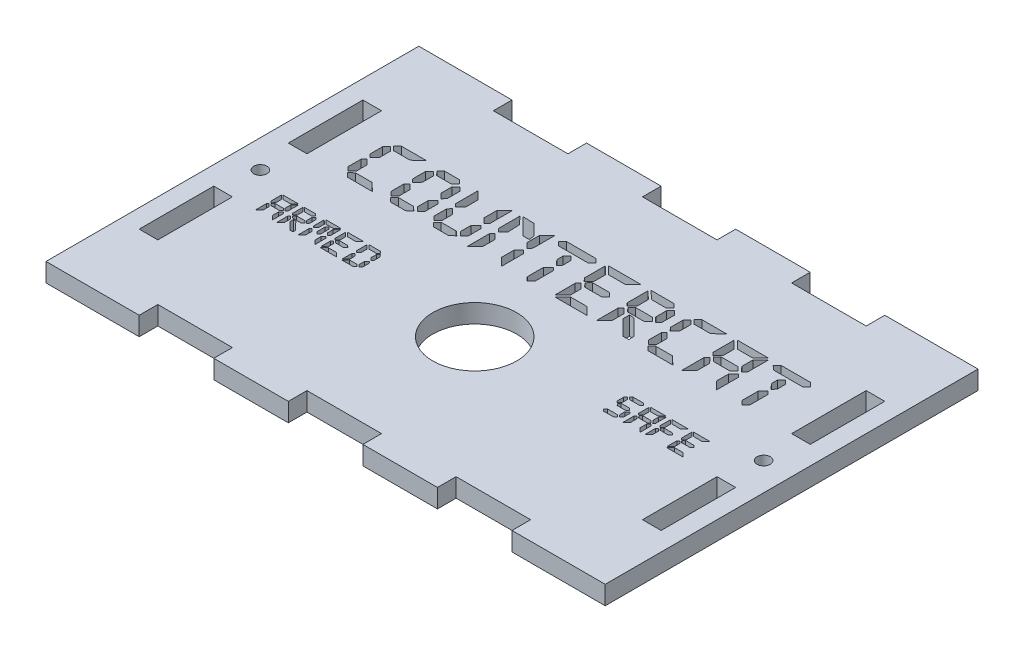
from build123d import *

# Parameters (mm, degrees)
SKETCH1_W                 = 190.5
SKETCH1_H                 = 127
BOSS_EXTRUDE1_DEPTH       = 6.35
SKETCH13_W                = 25.4
SKETCH13_H                = 6.35
CUT_EXTRUDE6_DEPTH        = 6.35
LPATTERN7_COUNT           = 2
LPATTERN7_PITCH           = 120.65
SKETCH14_W                = 6.35
SKETCH14_H                = 25.4
CUT_EXTRUDE7_DEPTH        = 6.35
F_8_CLEARANCE_HOLE1_D     = 4.4958
F_8_CLEARANCE_HOLE1_DEPTH = 10.16
F_8_CLEARANCE_HOLE1_TIP   = 1.350674586
SKETCH18_R                = 14.2875
CUT_EXTRUDE9_DEPTH        = 7.62
CUT_EXTRUDE10_DEPTH       = 10.16
CUT_EXTRUDE11_DEPTH       = 10.16


with BuildPart() as part:
    # Sketch1 → Boss-Extrude1 (new body)
    with BuildSketch(Plane(origin=(0, 0, 0), x_dir=(1, 0, 0), z_dir=(0, 1, 0))):
        with Locations((95.25, 63.5)):
            Rectangle(SKETCH1_W, SKETCH1_H)
    extrude(amount=BOSS_EXTRUDE1_DEPTH)

    # Sketch13 → Cut-Extrude6 (cut)
    with BuildSketch(Plane(origin=(0, 6.35, 0), x_dir=(1, 0, 0), z_dir=(0, 1, 0))):
        with Locations((44.45, 3.175)):
            Rectangle(SKETCH13_W, SKETCH13_H)
        with Locations((95.25, 3.175)):
            Rectangle(SKETCH13_W, SKETCH13_H)
        with Locations((146.05, 3.175)):
            Rectangle(SKETCH13_W, SKETCH13_H)
    cut_extrude6 = extrude(amount=-CUT_EXTRUDE6_DEPTH, mode=Mode.SUBTRACT)

    # LPattern7: Cut-Extrude6 ×2
    with Locations(*[(0, 0, -i * LPATTERN7_PITCH) for i in range(1, LPATTERN7_COUNT)]):
        add(cut_extrude6, mode=Mode.SUBTRACT)

    # Sketch14 → Cut-Extrude7 (cut)
    with BuildSketch(Plane(origin=(0, 6.35, 0), x_dir=(1, 0, 0), z_dir=(0, 1, 0))):
        with Locations((9.525, 38.1)):
            Rectangle(SKETCH14_W, SKETCH14_H)
        with Locations((180.975, 38.1)):
            Rectangle(SKETCH14_W, SKETCH14_H)
        with Locations((180.975, 88.9)):
            Rectangle(SKETCH14_W, SKETCH14_H)
        with Locations((9.525, 88.9)):
            Rectangle(SKETCH14_W, SKETCH14_H)
    extrude(amount=-CUT_EXTRUDE7_DEPTH, mode=Mode.SUBTRACT)

    # #8 Clearance Hole1
    with Locations(Plane(origin=(0, 6.35, 0), x_dir=(1, 0, 0), z_dir=(0, 1, 0))):
        with Locations((9.525, 63.5), (180.975, 63.5)):
            Hole(F_8_CLEARANCE_HOLE1_D / 2, depth=F_8_CLEARANCE_HOLE1_DEPTH)
            with Locations((0, 0, -(F_8_CLEARANCE_HOLE1_DEPTH + F_8_CLEARANCE_HOLE1_TIP / 2))):  # 118° drill point
                Cone(0, F_8_CLEARANCE_HOLE1_D / 2, F_8_CLEARANCE_HOLE1_TIP, mode=Mode.SUBTRACT)

    # Sketch18 → Cut-Extrude9 (cut)
    with BuildSketch(Plane(origin=(0, 6.35, 0), x_dir=(1, 0, 0), z_dir=(0, 1, 0))):
        with Locations((95.25, 50.8)):
            Circle(SKETCH18_R)
    extrude(amount=-CUT_EXTRUDE9_DEPTH, mode=Mode.SUBTRACT)

    # Sketch20 → Cut-Extrude10 (cut)
    with BuildSketch(Plane(origin=(0, 6.35, 0), x_dir=(1, 0, 0), z_dir=(0, 1, 0))):
        Polygon((26.542086331, 76.2), (25.184041857, 77.528973185), (26.542086331, 78.85794637), (32.152844997, 78.85794637), (35.047514716, 76.2), align=None)
        Polygon((35.047514716, 94.539829954), (32.152844997, 91.881883584), (26.542086331, 91.881883584), (25.184041857, 93.223315893), (26.542086331, 94.539829954), align=None)
        Polygon((26.143394375, 87.550261609), (24.482177894, 85.830902551), (23.485448005, 86.873315893), (23.485448005, 91.229856115), (24.81442119, 92.587900589), (26.143394375, 91.229856115), align=None)
        Polygon((23.485448005, 79.418606933), (24.843492479, 78.060562459), (26.201536952, 79.418606933), (26.201536952, 83.098201439), (24.5029431, 84.796795291), (23.485448005, 83.779300196), align=None)
        Polygon((49.79911707, 86.811020275), (48.802387181, 85.768606933), (47.1411707, 87.487965991), (47.1411707, 91.167560497), (48.470143885, 92.525604971), (49.79911707, 91.167560497), align=None)
        Polygon((47.631229562, 93.223315893), (46.273185088, 91.881883584), (41.160791367, 91.881883584), (39.985480706, 93.223315893), (41.160791367, 94.539829954), (46.273185088, 94.539829954), align=None)
        Polygon((49.79911707, 79.397841727), (48.470143885, 78.060562459), (47.1411707, 79.397841727), (47.1411707, 83.03175278), (48.802387181, 84.705428385), (49.79911707, 83.700392413), align=None)
        Polygon((40.762099411, 87.487965991), (39.10088293, 85.768606933), (38.104153041, 86.811020275), (38.104153041, 91.167560497), (39.433126226, 92.525604971), (40.762099411, 91.167560497), align=None)
        Polygon((38.104153041, 79.435219097), (39.462197515, 78.077174624), (40.820241988, 79.435219097), (40.820241988, 83.114813604), (39.121648136, 84.813407456), (38.104153041, 83.795912361), align=None)
        Polygon((41.160791367, 76.2), (39.802746893, 77.528973185), (41.160791367, 78.85794637), (46.273185088, 78.85794637), (47.813963375, 77.528973185), (46.273185088, 76.2), align=None)
        Polygon((64.417822106, 79.397841727), (63.088848921, 78.060562459), (61.759875736, 79.397841727), (61.759875736, 83.03175278), (63.421092217, 84.705428385), (64.417822106, 83.700392413), align=None)
        Polygon((52.722858077, 79.435219097), (54.051831262, 78.077174624), (55.380804447, 79.435219097), (55.380804447, 83.114813604), (53.719587966, 84.813407456), (52.722858077, 83.795912361), align=None)
        Polygon((55.779496403, 76.2), (54.421451929, 77.528973185), (55.779496403, 78.85794637), (60.891890124, 78.85794637), (62.432668411, 77.528973185), (60.891890124, 76.2), align=None)
        Polygon((64.417822106, 86.835938522), (63.421092217, 85.768606933), (61.759875736, 87.529496403), (61.759875736, 91.802975801), (64.417822106, 94.606278613), align=None)
        Polygon((52.722858077, 94.469228254), (55.438947024, 91.707455853), (55.438947024, 87.504578156), (53.740353172, 85.768606933), (52.722858077, 86.819326357), align=None)
        Polygon((69.999509483, 83.015140615), (69.999509483, 78.833028123), (67.341563113, 76.133551341), (67.341563113, 83.692086331), (68.338293002, 84.705428385), align=None)
        Polygon((67.341563113, 86.773642904), (67.341563113, 94.070536298), (69.812622629, 91.549640288), (69.999509483, 87.458894702), (68.338293002, 85.768606933), align=None)
        Polygon((79.036527142, 83.700392413), (79.036527142, 76.2), (76.378580772, 78.878711576), (76.378580772, 83.03175278), (78.039797253, 84.705428385), align=None)
        Polygon((76.378580772, 87.504578156), (76.378580772, 91.707455853), (79.036527142, 94.469228254), (79.036527142, 86.819326357), (78.039797253, 85.768606933), align=None)
        Polygon((67.943754088, 94.469228254), (71.914061478, 94.340483976), (75.639339438, 90.532145193), (75.846991498, 88.779561805), (73.633420536, 88.779561805), align=None)
        Polygon((89.136723349, 77.466677567), (87.807750164, 76.133551341), (86.478776978, 77.466677567), (86.478776978, 83.035905821), (88.13999346, 84.705428385), (89.136723349, 83.704545455), align=None)
        Polygon((89.136723349, 86.844244604), (88.13999346, 85.768606933), (86.478776978, 87.541955526), (86.478776978, 89.689077829), (87.807750164, 91.084499673), (89.136723349, 89.689077829), align=None)
        Polygon((94.186821452, 93.223315893), (92.808011772, 91.881883584), (82.782570307, 91.881883584), (81.428678875, 93.223315893), (82.782570307, 94.539829954), (92.808011772, 94.539829954), align=None)
        Polygon((108.141039895, 94.539829954), (105.42910399, 91.881883584), (99.818345324, 91.881883584), (97.102256377, 94.539829954), align=None)
        Polygon((108.141039895, 76.2), (97.102256377, 76.2), (99.818345324, 78.85794637), (105.424950948, 78.85794637), align=None)
        Polygon((99.236919555, 83.03175278), (99.236919555, 79.406147809), (96.578973185, 76.802190974), (96.578973185, 83.712851537), (97.575703074, 84.705428385), align=None)
        Polygon((96.578973185, 86.819326357), (96.578973185, 93.933485939), (99.236919555, 91.329529104), (99.236919555, 87.541955526), (97.575703074, 85.768606933), align=None)
        Polygon((105.088554611, 86.831785481), (106.446599084, 85.502812296), (105.088554611, 84.173839111), (99.295062132, 84.173839111), (98.119751472, 85.502812296), (99.295062132, 86.831785481), align=None)
        Polygon((115.184597776, 81.420372793), (115.184597776, 83.642249836), (116.912262917, 83.455362982), (122.240614781, 78.081327665), (122.315369523, 76.2), (120.359287116, 76.2), align=None)
        Polygon((113.855624591, 83.03175278), (113.855624591, 78.878711576), (111.197678221, 76.2), (111.197678221, 83.700392413), (112.19440811, 84.705428385), align=None)
        Polygon((111.197678221, 86.819326357), (111.197678221, 93.933485939), (113.855624591, 91.329529104), (113.855624591, 87.541955526), (112.19440811, 85.768606933), align=None)
        Polygon((119.707259647, 86.831785481), (121.06530412, 85.502812296), (119.707259647, 84.173839111), (113.913767168, 84.173839111), (112.738456508, 85.502812296), (113.913767168, 86.831785481), align=None)
        Polygon((122.89264225, 86.811020275), (121.895912361, 85.768606933), (120.23469588, 87.487965991), (120.23469588, 91.167560497), (121.563669065, 92.525604971), (122.89264225, 91.167560497), align=None)
        Polygon((120.724754742, 93.223315893), (119.366710268, 91.881883584), (114.43705036, 91.881883584), (111.5382276, 94.539829954), (119.366710268, 94.539829954), align=None)
        Polygon((128.873021583, 76.2), (127.514977109, 77.528973185), (128.873021583, 78.85794637), (134.483780249, 78.85794637), (137.378449967, 76.2), align=None)
        Polygon((137.378449967, 94.539829954), (134.483780249, 91.881883584), (128.873021583, 91.881883584), (127.514977109, 93.223315893), (128.873021583, 94.539829954), align=None)
        Polygon((128.474329627, 87.550261609), (126.813113146, 85.830902551), (125.816383257, 86.873315893), (125.816383257, 91.229856115), (127.145356442, 92.587900589), (128.474329627, 91.229856115), align=None)
        Polygon((125.816383257, 79.418606933), (127.174427731, 78.060562459), (128.532472204, 79.418606933), (128.532472204, 83.098201439), (126.833878352, 84.796795291), (125.816383257, 83.779300196), align=None)
        Polygon((151.5029431, 94.539829954), (148.786854153, 91.881883584), (143.674460432, 91.881883584), (140.958371485, 94.539829954), align=None)
        Polygon((143.093034663, 83.015140615), (143.093034663, 78.833028123), (140.435088293, 76.133551341), (140.435088293, 83.692086331), (141.431818182, 84.705428385), align=None)
        Polygon((140.435088293, 86.819326357), (140.435088293, 93.933485939), (143.093034663, 91.329529104), (143.093034663, 87.541955526), (141.431818182, 85.768606933), align=None)
        Polygon((152.130052322, 83.700392413), (152.130052322, 76.2), (149.472105952, 78.878711576), (149.472105952, 83.03175278), (151.133322433, 84.705428385), align=None)
        Polygon((149.472105952, 87.575179856), (149.472105952, 91.433355134), (152.130052322, 94.037311969), (152.130052322, 86.831785481), (151.133322433, 85.768606933), align=None)
        Polygon((148.944669719, 86.831785481), (150.302714192, 85.502812296), (148.944669719, 84.173839111), (143.15117724, 84.173839111), (141.975866579, 85.502812296), (143.15117724, 86.831785481), align=None)
        Polygon((162.230248528, 77.466677567), (160.901275343, 76.133551341), (159.572302158, 77.466677567), (159.572302158, 83.035905821), (161.23351864, 84.705428385), (162.230248528, 83.704545455), align=None)
        Polygon((162.230248528, 86.844244604), (161.23351864, 85.768606933), (159.572302158, 87.541955526), (159.572302158, 89.689077829), (160.901275343, 91.084499673), (162.230248528, 89.689077829), align=None)
        Polygon((167.280346632, 93.223315893), (165.901536952, 91.881883584), (155.876095487, 91.881883584), (154.522204055, 93.223315893), (155.876095487, 94.539829954), (165.901536952, 94.539829954), align=None)
    extrude(amount=-CUT_EXTRUDE10_DEPTH, mode=Mode.SUBTRACT)

    # Sketch22 → Cut-Extrude11 (cut)
    with BuildSketch(Plane(origin=(0, 6.35, 0), x_dir=(1, 0, 0), z_dir=(0, 1, 0))):
        Polygon((26.025032701, 59.969914977), (24.666988228, 58.640941792), (22.110791367, 58.640941792), (20.752746893, 59.969914977), align=None)
        Polygon((21.820078483, 54.207570307), (21.820078483, 52.116514061), (20.491105298, 50.76677567), (20.491105298, 54.546043165), (20.989470242, 55.052714192), align=None)
        Polygon((20.491105298, 56.109663179), (20.491105298, 59.666742969), (21.820078483, 58.364764552), (21.820078483, 56.470977763), (20.989470242, 55.584303466), align=None)
        Polygon((26.338587312, 54.550196207), (26.338587312, 50.8), (25.009614127, 52.139355788), (25.009614127, 54.21587639), (25.840222368, 55.052714192), align=None)
        Polygon((25.009614127, 56.487589928), (25.009614127, 58.416677567), (26.338587312, 59.718655984), (26.338587312, 56.11589274), (25.840222368, 55.584303466), align=None)
        Polygon((24.74589601, 56.11589274), (25.424918247, 55.451406148), (24.74589601, 54.786919555), (21.849149771, 54.786919555), (21.261494441, 55.451406148), (21.849149771, 56.11589274), align=None)
        Polygon((29.793917593, 53.410186396), (29.793917593, 54.521124918), (30.657750164, 54.427681491), (33.321926095, 51.740663833), (33.359303466, 50.8), (32.381262263, 50.8), align=None)
        Polygon((29.129431001, 54.21587639), (29.129431001, 52.139355788), (27.800457816, 50.8), (27.800457816, 54.550196207), (28.29882276, 55.052714192), align=None)
        Polygon((27.800457816, 56.109663179), (27.800457816, 59.666742969), (29.129431001, 58.364764552), (29.129431001, 56.470977763), (28.29882276, 55.584303466), align=None)
        Polygon((32.055248528, 56.11589274), (32.734270765, 55.451406148), (32.055248528, 54.786919555), (29.158502289, 54.786919555), (28.570846959, 55.451406148), (29.158502289, 56.11589274), align=None)
        Polygon((33.64793983, 56.105510137), (33.149574886, 55.584303466), (32.318966645, 56.443982995), (32.318966645, 58.283780249), (32.983453237, 58.962802485), (33.64793983, 58.283780249), align=None)
        Polygon((32.563996076, 59.311657946), (31.884973839, 58.640941792), (29.420143885, 58.640941792), (27.970732505, 59.969914977), (31.884973839, 59.969914977), align=None)
        Polygon((40.643737737, 59.969914977), (39.285693264, 58.640941792), (36.729496403, 58.640941792), (35.375604971, 59.969914977), align=None)
        Polygon((36.438783519, 54.207570307), (36.438783519, 52.116514061), (35.109810334, 50.76677567), (35.109810334, 54.546043165), (35.608175278, 55.052714192), align=None)
        Polygon((35.109810334, 56.109663179), (35.109810334, 59.672972531), (36.438783519, 58.370994114), (36.438783519, 56.473054284), (35.608175278, 55.584303466), align=None)
        Polygon((40.824395029, 54.550196207), (40.824395029, 50.8), (39.495421844, 52.139355788), (39.495421844, 54.21587639), (40.326030085, 55.052714192), align=None)
        Polygon((39.495421844, 56.446059516), (39.495421844, 58.285856769), (40.824395029, 59.587835186), (40.824395029, 56.099280576), (40.326030085, 55.584303466), align=None)
        Polygon((37.369064748, 57.675359712), (38.039780903, 58.375147155), (38.698037933, 57.675359712), (38.698037933, 54.917740353), (38.039780903, 54.205493787), (37.369064748, 54.917740353), align=None)
        Polygon((48.200196207, 59.969914977), (46.844228254, 58.640941792), (44.038848921, 58.640941792), (42.680804447, 59.969914977), align=None)
        Polygon((48.200196207, 50.8), (42.680804447, 50.8), (44.038848921, 52.128973185), (46.842151733, 52.128973185), align=None)
        Polygon((43.748136037, 54.21587639), (43.748136037, 52.403073905), (42.419162852, 51.101095487), (42.419162852, 54.556425768), (42.917527796, 55.052714192), align=None)
        Polygon((42.419162852, 56.109663179), (42.419162852, 59.666742969), (43.748136037, 58.364764552), (43.748136037, 56.470977763), (42.917527796, 55.584303466), align=None)
        Polygon((46.673953564, 56.11589274), (47.352975801, 55.451406148), (46.673953564, 54.786919555), (43.777207325, 54.786919555), (43.189551995, 55.451406148), (43.777207325, 56.11589274), align=None)
        Polygon((51.057488555, 54.222105952), (51.057488555, 52.417609549), (49.72851537, 51.065794637), (49.72851537, 54.550196207), (50.226880314, 55.052714192), align=None)
        Polygon((49.72851537, 56.109663179), (49.72851537, 59.666742969), (51.057488555, 58.364764552), (51.057488555, 56.470977763), (50.226880314, 55.584303466), align=None)
        Polygon((50.025457816, 50.8), (51.333665795, 52.128973185), (53.889862655, 52.128973185), (54.568884892, 51.464486593), (53.889862655, 50.8), align=None)
        Polygon((55.575997384, 56.105510137), (55.07763244, 55.584303466), (54.247024199, 56.443982995), (54.247024199, 58.283780249), (54.911510791, 58.962802485), (55.575997384, 58.283780249), align=None)
        Polygon((54.583420536, 59.311657946), (53.9043983, 58.640941792), (51.348201439, 58.640941792), (49.990156965, 59.969914977), (53.9043983, 59.969914977), align=None)
        Polygon((55.575997384, 52.398920863), (54.911510791, 51.73028123), (54.247024199, 52.398920863), (54.247024199, 54.21587639), (55.07763244, 55.052714192), (55.575997384, 54.550196207), align=None)
        Polygon((166.154872466, 59.969914977), (164.798904513, 58.640941792), (161.99352518, 58.640941792), (160.635480706, 59.969914977), align=None)
        Polygon((166.154872466, 50.8), (160.635480706, 50.8), (161.99352518, 52.128973185), (164.796827992, 52.128973185), align=None)
        Polygon((161.702812296, 54.21587639), (161.702812296, 52.403073905), (160.373839111, 51.101095487), (160.373839111, 54.556425768), (160.872204055, 55.052714192), align=None)
        Polygon((160.373839111, 56.109663179), (160.373839111, 59.666742969), (161.702812296, 58.364764552), (161.702812296, 56.470977763), (160.872204055, 55.584303466), align=None)
        Polygon((164.628629823, 56.11589274), (165.30765206, 55.451406148), (164.628629823, 54.786919555), (161.731883584, 54.786919555), (161.144228254, 55.451406148), (161.731883584, 56.11589274), align=None)
        Polygon((158.845519948, 59.969914977), (157.489551995, 58.640941792), (154.684172662, 58.640941792), (153.326128188, 59.969914977), align=None)
        Polygon((154.393459778, 54.209646828), (154.393459778, 52.380232178), (153.064486593, 51.032570307), (153.064486593, 54.546043165), (153.562851537, 55.052714192), align=None)
        Polygon((153.064486593, 56.109663179), (153.064486593, 59.666742969), (154.393459778, 58.364764552), (154.393459778, 56.470977763), (153.562851537, 55.584303466), align=None)
        Polygon((157.319277305, 56.11589274), (157.998299542, 55.451406148), (157.319277305, 54.786919555), (154.422531066, 54.786919555), (153.834875736, 55.451406148), (154.422531066, 56.11589274), align=None)
        Polygon((151.289061478, 59.969914977), (149.931017005, 58.640941792), (147.374820144, 58.640941792), (146.01677567, 59.969914977), align=None)
        Polygon((147.08410726, 54.207570307), (147.08410726, 52.116514061), (145.755134075, 50.76677567), (145.755134075, 54.546043165), (146.253499019, 55.052714192), align=None)
        Polygon((145.755134075, 56.109663179), (145.755134075, 59.666742969), (147.08410726, 58.364764552), (147.08410726, 56.470977763), (146.253499019, 55.584303466), align=None)
        Polygon((151.602616089, 54.550196207), (151.602616089, 50.8), (150.273642904, 52.139355788), (150.273642904, 54.21587639), (151.104251145, 55.052714192), align=None)
        Polygon((150.273642904, 56.487589928), (150.273642904, 58.416677567), (151.602616089, 59.718655984), (151.602616089, 56.11589274), (151.104251145, 55.584303466), align=None)
        Polygon((150.009924787, 56.11589274), (150.688947024, 55.451406148), (150.009924787, 54.786919555), (147.113178548, 54.786919555), (146.525523218, 55.451406148), (147.113178548, 56.11589274), align=None)
        Polygon((144.293263571, 59.311657946), (143.628776978, 58.640941792), (140.07792675, 58.640941792), (139.386445389, 59.311657946), (140.073773708, 59.969914977), (143.605935252, 59.969914977), align=None)
        Polygon((144.293263571, 52.409303466), (143.628776978, 51.73028123), (142.964290386, 52.409303466), (142.964290386, 54.249100719), (143.794898627, 55.098397646), (144.293263571, 54.589650098), align=None)
        Polygon((139.774754742, 56.475130804), (138.944146501, 55.615451275), (138.445781557, 56.136657946), (138.445781557, 58.314928058), (139.110268149, 58.993950294), (139.774754742, 58.314928058), align=None)
        Polygon((139.124803793, 50.8), (138.445781557, 51.464486593), (139.110268149, 52.128973185), (142.619587966, 52.128973185), (143.300686723, 51.464486593), (142.621664487, 50.8), align=None)
        Polygon((142.700572269, 56.11589274), (143.379594506, 55.451406148), (142.700572269, 54.786919555), (139.80382603, 54.786919555), (139.2161707, 55.451406148), (139.80382603, 56.11589274), align=None)
    extrude(amount=-CUT_EXTRUDE11_DEPTH, mode=Mode.SUBTRACT)


solid = part.part
